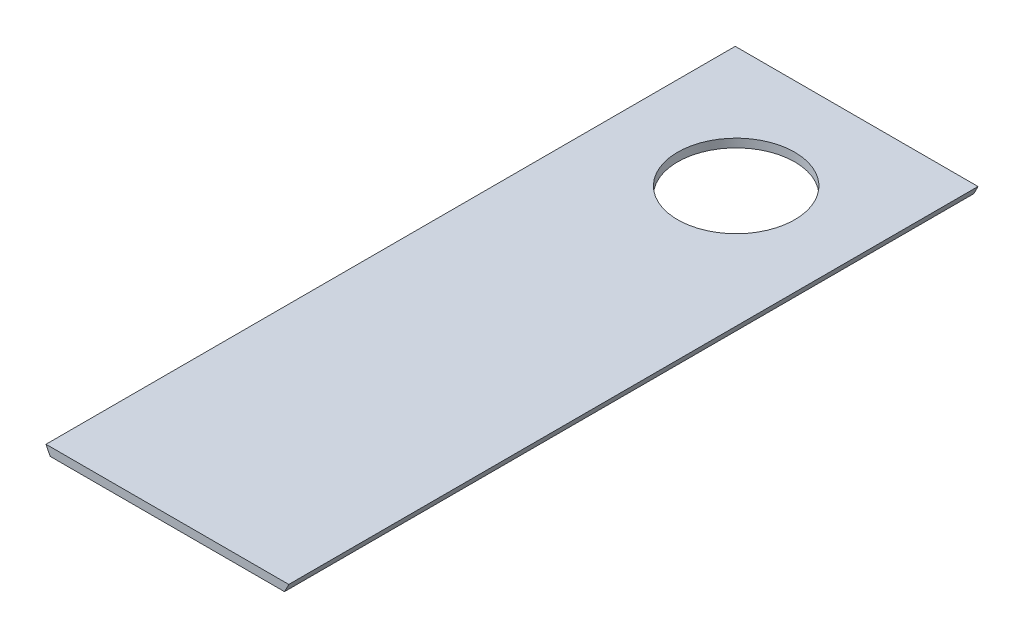
from build123d import *

# Parameters (mm, degrees)
BOSS_EXTRUDE1_DEPTH = 261.62
SKETCH3_R           = 22.225
CUT_EXTRUDE1_DEPTH  = 266.665663227


with BuildPart() as part:
    # Sketch2 → Boss-Extrude1 (new body)
    with BuildSketch(Plane.XY):
        with BuildLine():
            Line((-44.45, -24.593444248), (44.45, -24.593444248))
            ThreePointArc((44.45, -24.593444248), (45.291168316, -23.007609015), (46.075781684, -21.393044248))
            Line((46.075781684, -21.393044248), (-46.075781684, -21.393044248))
            ThreePointArc((-46.075781684, -21.393044248), (-45.291168316, -23.007609015), (-44.45, -24.593444248))
        make_face()
    extrude(amount=BOSS_EXTRUDE1_DEPTH)

    # Sketch3 → Cut-Extrude1 (cut, through all)
    with BuildSketch(Plane.XZ.offset(24.593444248)):
        with Locations((0, 45.72)):
            Circle(SKETCH3_R)
    extrude(amount=-CUT_EXTRUDE1_DEPTH, mode=Mode.SUBTRACT)


solid = part.part
